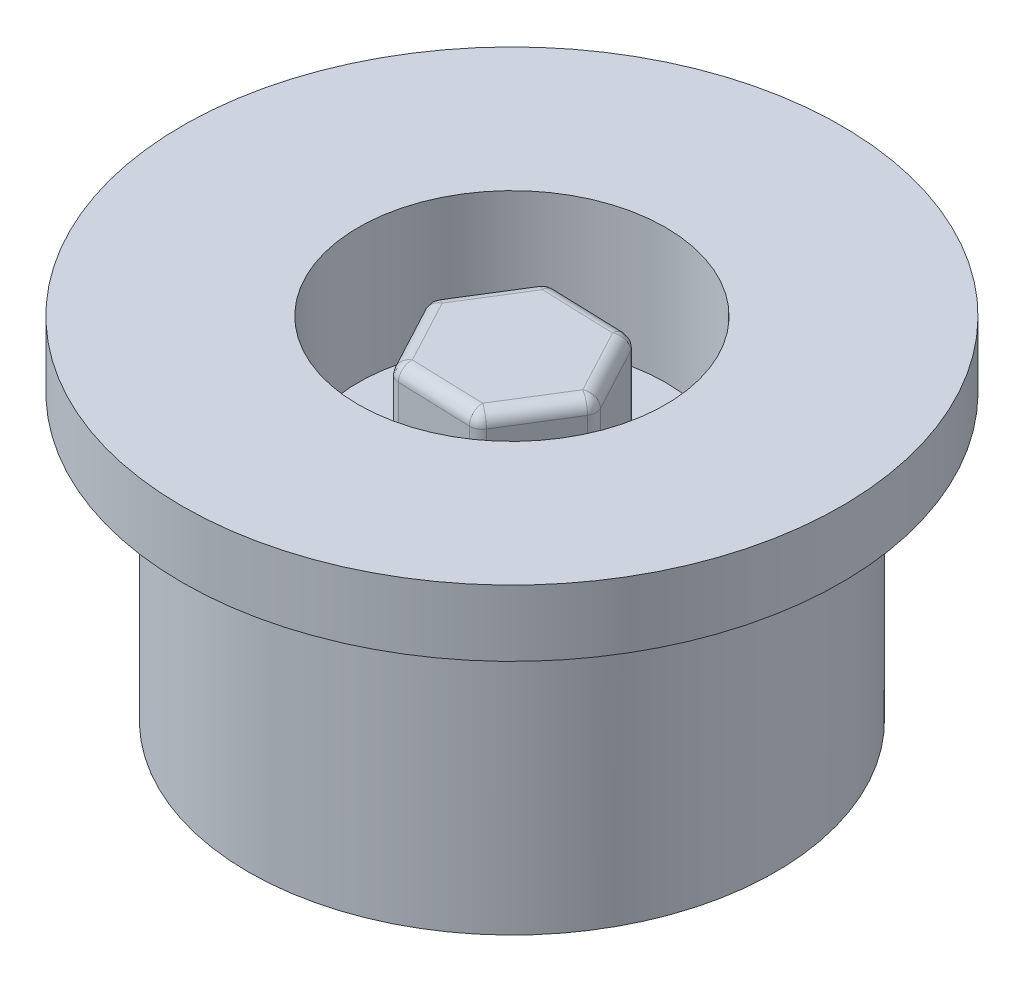
from build123d import *

# Parameters (mm, degrees)
SKETCH1_R           = 6.8961
SKETCH1_R_2         = 2.3241
BOSS_EXTRUDE1_DEPTH = 2.794
SKETCH2_R           = 2.3241
BOSS_EXTRUDE2_DEPTH = 0.762
BOSS_EXTRUDE3_DEPTH = 1.651
SKETCH5_R           = 8.206879239
SKETCH5_R_2         = 3.9875
CUT_EXTRUDE1_DEPTH  = 11.144891642
SKETCH6_R           = 4.9875
SKETCH6_R_2         = 3.9875
BOSS_EXTRUDE4_DEPTH = 1
FILLET1_R           = 0.2
SKETCH7_R           = 3.9875
BOSS_EXTRUDE5_DEPTH = 2.5


with BuildPart() as part:
    # Sketch1 → Boss-Extrude1 (new body)
    with BuildSketch(Plane(origin=(0, 0, 0), x_dir=(1, 0, 0), z_dir=(0, 1, 0))):
        Circle(SKETCH1_R)
        Circle(SKETCH1_R_2, mode=Mode.SUBTRACT)
    extrude(amount=BOSS_EXTRUDE1_DEPTH)

    # Sketch2 → Boss-Extrude2 (add)
    with BuildSketch(Plane.XZ):
        Circle(SKETCH2_R)
    extrude(amount=-BOSS_EXTRUDE2_DEPTH)

    # Sketch3 → Boss-Extrude3 (add)
    with BuildSketch(Plane(origin=(0, 0.762, 0), x_dir=(1, 0, 0), z_dir=(0, 1, 0))):
        with BuildLine():
            Line((-0.495805164, 1.156686678), (0.614449488, 1.120298857))
            ThreePointArc((0.614449488, 1.120298857), (0.708812351, 1.091670316), (0.776218716, 1.01969584))
            Line((0.776218716, 1.01969584), (1.299833265, 0.039993196))
            ThreePointArc((1.299833265, 0.039993196), (1.322221652, -0.056041711), (1.293593111, -0.150404573))
            Line((1.293593111, -0.150404573), (0.706953007, -1.093719397))
            ThreePointArc((0.706953007, -1.093719397), (0.634978532, -1.161125762), (0.538943625, -1.183514149))
            Line((0.538943625, -1.183514149), (-0.571311028, -1.147126328))
            ThreePointArc((-0.571311028, -1.147126328), (-0.66567389, -1.118497787), (-0.733080255, -1.046523312))
            Line((-0.733080255, -1.046523312), (-1.256694804, -0.066820667))
            ThreePointArc((-1.256694804, -0.066820667), (-1.279083191, 0.02921424), (-1.25045465, 0.123577102))
            Line((-1.25045465, 0.123577102), (-0.663814546, 1.066891925))
            ThreePointArc((-0.663814546, 1.066891925), (-0.591840071, 1.134298291), (-0.495805164, 1.156686678))
        make_face()
    extrude(amount=BOSS_EXTRUDE3_DEPTH)

    # Sketch5 → Cut-Extrude1 (cut, through all)
    with BuildSketch(Plane(origin=(0, 2.794, 0), x_dir=(1, 0, 0), z_dir=(0, 1, 0))):
        Circle(SKETCH5_R)
        Circle(SKETCH5_R_2, mode=Mode.SUBTRACT)
    extrude(amount=-CUT_EXTRUDE1_DEPTH, mode=Mode.SUBTRACT)

    # Sketch6 → Boss-Extrude4 (add)
    with BuildSketch(Plane(origin=(0, 2.794, 0), x_dir=(1, 0, 0), z_dir=(0, 1, 0))):
        Circle(SKETCH6_R)
        Circle(SKETCH6_R_2, mode=Mode.SUBTRACT)
    extrude(amount=-BOSS_EXTRUDE4_DEPTH)

    # Fillet1
    fillet1_edges = [part.edges().sort_by_distance(p)[0] for p in [
        (1.038025991, 2.413, -0.529844518),
        (1.322221652, 2.413, 0.056041711),
        (1.000273059, 2.413, 0.622061985),
        (0.634978532, 2.413, 1.161125762),
        (-0.016183701, 2.413, 1.165320239),
        (-0.66567389, 2.413, 1.118497787),
        (-0.99488753, 2.413, 0.556671989),
        (-1.279083191, 2.413, -0.02921424),
        (-0.957134598, 2.413, -0.595234514),
        (-0.591840071, 2.413, -1.134298291),
        (0.059322162, 2.413, -1.138492768),
        (0.708812351, 2.413, -1.091670316),
    ]]
    fillet(fillet1_edges, radius=FILLET1_R)

    # Sketch7 → Boss-Extrude5 (add)
    with BuildSketch(Plane.XZ):
        Circle(SKETCH7_R)
    extrude(amount=BOSS_EXTRUDE5_DEPTH)


solid = part.part
